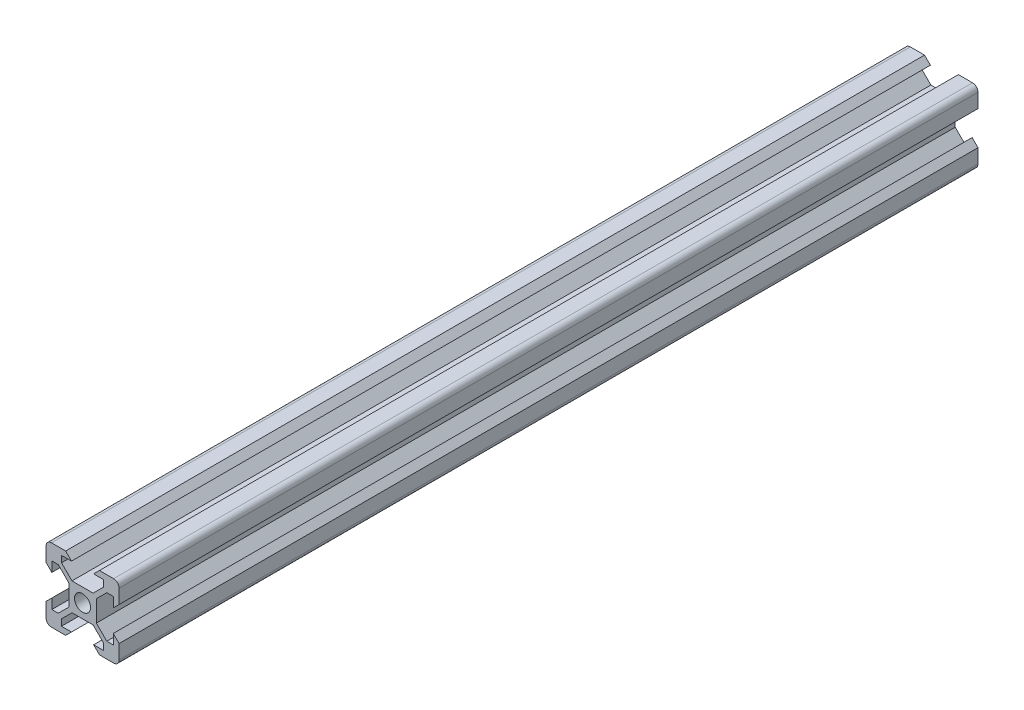
from build123d import *

# Parameters (mm, degrees)
SKETCH1_R           = 4.4
BOSS_EXTRUDE1_DEPTH = 235


with BuildPart() as part:
    # Sketch1 → Boss-Extrude1 (new, symmetric)
    with BuildSketch(Plane.XY):
        with BuildLine():
            Line((-13.271281672, 11.512), (-7.544, 5.784718328))
            Line((-7.544, 5.784718328), (-7.544, -5.784718328))
            Line((-7.544, -5.784718328), (-13.271281672, -11.512))
            Line((-13.271281672, -11.512), (-16.8, -11.512))
            Line((-16.8, -11.512), (-16.8, -6.051976926))
            Line((-16.8, -6.051976926), (-20, -9.251976926))
            Line((-20, -9.251976926), (-20, -17))
            ThreePointArc((-20, -17), (-19.121320344, -19.121320344), (-17, -20))
            Line((-17, -20), (-9.251976926, -20))
            Line((-9.251976926, -20), (-6.051976926, -16.8))
            Line((-6.051976926, -16.8), (-11.512, -16.8))
            Line((-11.512, -16.8), (-11.512, -13.271281672))
            Line((-11.512, -13.271281672), (-5.784718328, -7.544))
            Line((-5.784718328, -7.544), (5.784718328, -7.544))
            Line((5.784718328, -7.544), (11.512, -13.271281672))
            Line((11.512, -13.271281672), (11.512, -16.8))
            Line((11.512, -16.8), (6.051976926, -16.8))
            Line((6.051976926, -16.8), (9.251976926, -20))
            Line((9.251976926, -20), (17, -20))
            ThreePointArc((17, -20), (19.121320344, -19.121320344), (20, -17))
            Line((20, -17), (20, -9.251976926))
            Line((20, -9.251976926), (16.8, -6.051976926))
            Line((16.8, -6.051976926), (16.8, -11.512))
            Line((16.8, -11.512), (13.271281672, -11.512))
            Line((13.271281672, -11.512), (7.544, -5.784718328))
            Line((7.544, -5.784718328), (7.544, 5.784718328))
            Line((7.544, 5.784718328), (13.271281672, 11.512))
            Line((13.271281672, 11.512), (16.8, 11.512))
            Line((16.8, 11.512), (16.8, 6.051976926))
            Line((16.8, 6.051976926), (20, 9.251976926))
            Line((20, 9.251976926), (20, 17))
            ThreePointArc((20, 17), (19.121320344, 19.121320344), (17, 20))
            Line((17, 20), (9.251976926, 20))
            Line((9.251976926, 20), (6.051976926, 16.8))
            Line((6.051976926, 16.8), (11.512, 16.8))
            Line((11.512, 16.8), (11.512, 13.271281672))
            Line((11.512, 13.271281672), (5.784718328, 7.544))
            Line((5.784718328, 7.544), (-5.784718328, 7.544))
            Line((-5.784718328, 7.544), (-11.512, 13.271281672))
            Line((-11.512, 13.271281672), (-11.512, 16.8))
            Line((-11.512, 16.8), (-6.051976926, 16.8))
            Line((-6.051976926, 16.8), (-9.251976926, 20))
            Line((-9.251976926, 20), (-17, 20))
            ThreePointArc((-17, 20), (-19.121320344, 19.121320344), (-20, 17))
            Line((-20, 17), (-20, 9.251976926))
            Line((-20, 9.251976926), (-16.8, 6.051976926))
            Line((-16.8, 6.051976926), (-16.8, 11.512))
            Line((-16.8, 11.512), (-13.271281672, 11.512))
        make_face()
        Circle(SKETCH1_R, mode=Mode.SUBTRACT)
    extrude(amount=BOSS_EXTRUDE1_DEPTH, both=True)


solid = part.part
